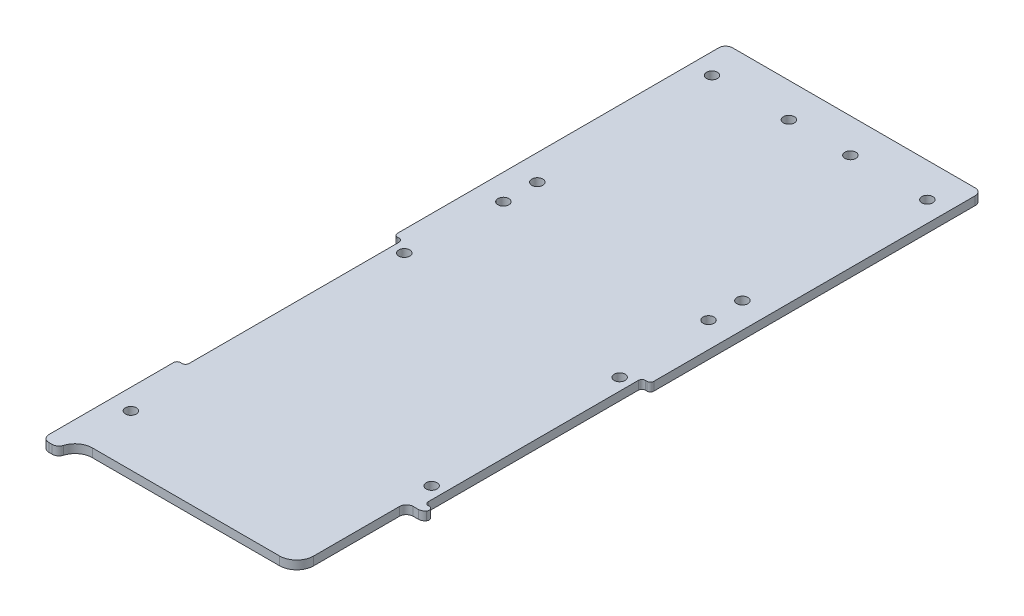
from build123d import *

# Parameters (mm, degrees)
SKETCH1_R               = 2.032
BOSS_EXTRUDE1_DEPTH     = 3.175
FILLET1_R               = 2.54
FILLET2_R               = 2.54
FILLET3_R               = 6.35
CUT_EXTRUDE1_DEPTH      = 136.673215063
FILLET4_R               = 6.35
FILLET5_R               = 2.54
SKETCH3_R               = 2.032
CUT_EXTRUDE2_DEPTH      = 136.673215063
CUT_EXTRUDE3_DEPTH      = 136.673215063
CUT_EXTRUDE3_DEPTH_BACK = 136.673215063
SKETCH4_W               = 3.175
SKETCH4_H               = 80.645
FILLET6_R               = 1.27


with BuildPart() as part:
    # Sketch1 → Boss-Extrude1 (new body)
    with BuildSketch(Plane(origin=(0, 0, 0), x_dir=(1, 0, 0), z_dir=(0, 1, 0))):
        Polygon((47.625, 127), (-47.625, 127), (-47.625, -127), (-41.275, -127), (-41.275, -120.65), (41.275, -120.65), (41.275, -127), (47.625, -127), align=None)
        with Locations((-39.999684148, -101.6)):
            Circle(SKETCH1_R, mode=Mode.SUBTRACT)
        with Locations((39.999684148, -69.85)):
            Circle(SKETCH1_R, mode=Mode.SUBTRACT)
        with Locations((-39.999684148, 0)):
            Circle(SKETCH1_R, mode=Mode.SUBTRACT)
        with Locations((-39.999684148, 114.3)):
            Circle(SKETCH1_R, mode=Mode.SUBTRACT)
        with Locations((-11.424684148, 114.3)):
            Circle(SKETCH1_R, mode=Mode.SUBTRACT)
        with Locations((39.999684148, 0)):
            Circle(SKETCH1_R, mode=Mode.SUBTRACT)
        with Locations((11.424684148, 114.3)):
            Circle(SKETCH1_R, mode=Mode.SUBTRACT)
        with Locations((39.999684148, 114.3)):
            Circle(SKETCH1_R, mode=Mode.SUBTRACT)
    extrude(amount=BOSS_EXTRUDE1_DEPTH)

    # Fillet1
    fillet1_edges = [part.edges().sort_by_distance(p)[0] for p in [
        (-47.625, 1.5875, -127),
        (47.625, 1.5875, -127),
        (47.625, 1.5875, 127),
        (-47.625, 1.5875, 127),
    ]]
    fillet(fillet1_edges, radius=FILLET1_R)

    # Fillet2
    fillet2_edges = [part.edges().sort_by_distance(p)[0] for p in [
        (41.275, 1.5875, 127),
        (-41.275, 1.5875, 127),
    ]]
    fillet(fillet2_edges, radius=FILLET2_R)

    # Fillet3
    fillet3_edges = [part.edges().sort_by_distance(p)[0] for p in [
        (41.275, 1.5875, 120.65),
        (-41.275, 1.5875, 120.65),
    ]]
    fillet(fillet3_edges, radius=FILLET3_R)

    # Sketch2 → Cut-Extrude1 (cut, through all)
    with BuildSketch(Plane.XZ):
        with BuildLine():
            Line((40.64508, 123.578690235), (40.64508, 79.88808))
            Line((40.64508, 79.88808), (47.625, 79.88808))
            Line((47.625, 79.88808), (47.625, 124.46))
            ThreePointArc((47.625, 124.46), (46.881051224, 126.256051224), (45.085, 127))
            Line((45.085, 127), (43.815, 127))
            ThreePointArc((43.815, 127), (42.297059666, 126.496530663), (41.380880287, 125.185714286))
            ThreePointArc((41.380880287, 125.185714286), (41.069166069, 124.356476684), (40.64508, 123.578690235))
        make_face()
    extrude(amount=-CUT_EXTRUDE1_DEPTH, mode=Mode.SUBTRACT)

    # Fillet4
    fillet4_edges = [part.edges().sort_by_distance(p)[0] for p in [
        (40.64508, 1.5875, 123.578690235),
    ]]
    fillet(fillet4_edges, radius=FILLET4_R)

    # Fillet5
    fillet5_edges = [part.edges().sort_by_distance(p)[0] for p in [
        (47.625, 1.5875, 79.88808),
        (40.64508, 1.5875, 79.88808),
    ]]
    fillet(fillet5_edges, radius=FILLET5_R)

    # Sketch3 → Cut-Extrude2 (cut, through all)
    with BuildSketch(Plane.XZ):
        with Locations((-38.102523434, -34.913768806)):
            Circle(SKETCH3_R)
        with Locations((-38.102523434, -47.490173279)):
            Circle(SKETCH3_R)
        with Locations((38.102523434, -47.490173279)):
            Circle(SKETCH3_R)
        with Locations((38.102523434, -34.913768806)):
            Circle(SKETCH3_R)
    extrude(amount=-CUT_EXTRUDE2_DEPTH, mode=Mode.SUBTRACT)

    # Sketch4 → Cut-Extrude3 (cut, two sides: drawn at the far end of the back side and taken through both)
    with BuildSketch(Plane(origin=(0, 3.175, 0), x_dir=(1, 0, 0), z_dir=(0, 1, 0)).offset(-CUT_EXTRUDE3_DEPTH_BACK)):
        with Locations((-46.0375, -36.5125)):
            Rectangle(SKETCH4_W, SKETCH4_H)
        with Locations((46.0375, -36.5125)):
            Rectangle(SKETCH4_W, SKETCH4_H)
    extrude(amount=CUT_EXTRUDE3_DEPTH + CUT_EXTRUDE3_DEPTH_BACK, mode=Mode.SUBTRACT)

    # Fillet6
    fillet6_edges = [part.edges().sort_by_distance(p)[0] for p in [
        (-44.45, 1.5875, -3.81),
        (-47.625, 1.5875, -3.81),
        (-47.625, 1.5875, 76.835),
        (-44.45, 1.5875, 76.835),
        (44.45, 1.5875, 76.835),
        (47.625, 1.5875, 76.835),
        (44.45, 1.5875, -3.81),
        (47.625, 1.5875, -3.81),
    ]]
    fillet(fillet6_edges, radius=FILLET6_R)


solid = part.part
